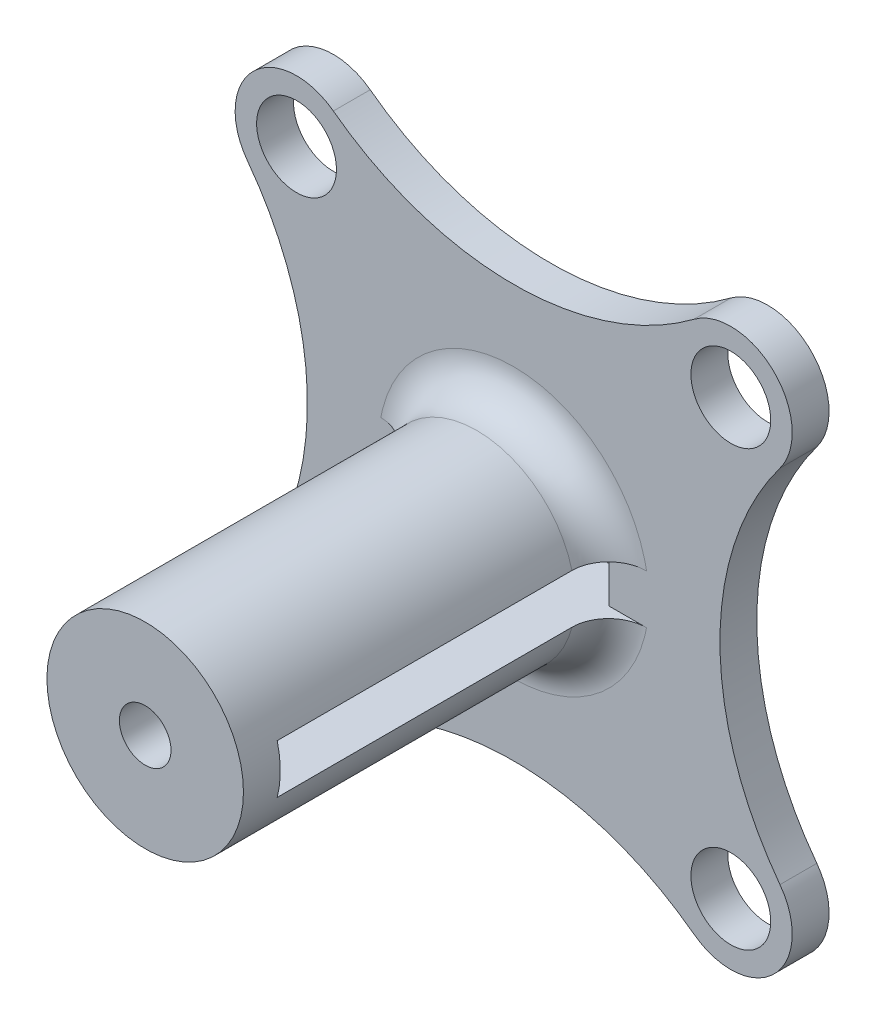
from build123d import *

# Parameters (mm, degrees)
CROQUIS1_R              = 3.2499999999997446
CROQUIS1_R_2            = 3.249999999997429
CROQUIS1_R_3            = 3.249999999998684
SALIENTE_EXTRUIR1_DEPTH = 3
CORTAR_EXTRUIR2_REACH   = 34.211
SALIENTE_EXTRUIR2_DEPTH = 30
SALIENTE_EXTRUIR3_START = -3
CROQUIS4_R              = 8.000000000001583
CROQUIS4_R_2            = 2.1
SALIENTE_EXTRUIR3_DEPTH = 3
REDONDEO1_R             = 3


with BuildPart() as part:
    # Croquis1 → Saliente-Extruir1 (new body)
    with BuildSketch(Plane.XY):
        with BuildLine():
            ThreePointArc((-14.681197845286842, 21.680313336544412), (-21.21320343559782, 21.213203435599436), (-21.680313336542973, 14.681197845289143))
            ThreePointArc((-21.680313336542973, 14.681197845289143), (-16.79377171834698, -4.4873e-13), (-21.680313336546256, -14.681197845289011))
            ThreePointArc((-21.680313336546256, -14.681197845289011), (-21.213203435602523, -21.213203435600768), (-14.68119784529118, -21.680313336546952))
            ThreePointArc((-14.68119784529118, -21.680313336546952), (-1.37456e-12, -16.793771718350733), (14.681197845287352, -21.68031333655022))
            ThreePointArc((14.681197845287352, -21.68031333655022), (21.21320343559837, -21.213203435605198), (21.680313336544117, -14.68119784529431))
            ThreePointArc((21.680313336544117, -14.68119784529431), (16.79377171834798, -4.8379e-12), (21.680313336547112, 14.681197845283641))
            ThreePointArc((21.680313336547112, 14.681197845283641), (21.213203435602864, 21.21320343559648), (14.681197845291681, 21.680313336541143))
            ThreePointArc((14.681197845291681, 21.680313336541143), (1.87813e-12, 16.793771718344924), (-14.681197845286842, 21.680313336544412))
        make_face()
        with Locations((-17.677669529663632, 17.677669529664712)):
            Circle(CROQUIS1_R, mode=Mode.SUBTRACT)
        with Locations((17.67766952966688, 17.677669529661795)):
            Circle(CROQUIS1_R_2, mode=Mode.SUBTRACT)
        with Locations((17.67766952966414, -17.677669529670524)):
            Circle(CROQUIS1_R_3, mode=Mode.SUBTRACT)
        with Locations((-17.677669529667213, -17.677669529666943)):
            Circle(CROQUIS1_R, mode=Mode.SUBTRACT)
    extrude(amount=SALIENTE_EXTRUIR1_DEPTH)

    # Croquis2 → Cortar-Extruir2 (cut, up to next)
    with BuildSketch(Plane.XY.offset(3), mode=Mode.PRIVATE) as cortar_extruir2_sk1:
        Polygon((3.0000001045733526, -6.64999997299992), (3.000000062696712, -2.0000000028022047), (7.7459667027131305, -1.9999999600613383), (7.745966666690224, 2.00000009954332), (3.000000026673777, 2.000000056802398), (2.999999984797136, 6.650000027000114), (-3.0000001046098235, 6.649999972965725), (-3.000000062733182, 2.00000000276801), (-7.745966702749602, 1.9999999600271434), (-7.7459666821165225, -2.00000003997286), (-3.000000026710248, -1.9999999972319937), (-2.9999999848336065, -6.6500000270343085), align=None)
    cortar_extruir2_tool1 = extrude(cortar_extruir2_sk1.sketch, amount=-CORTAR_EXTRUIR2_REACH, mode=Mode.PRIVATE) & part.part
    add(cortar_extruir2_tool1.solids().sort_by_distance((0, 0, 3))[0], mode=Mode.SUBTRACT)

    # Croquis3 → Saliente-Extruir2 (add)
    with BuildSketch(Plane.XY.offset(3)):
        with BuildLine():
            Line((3.000000026673777, 2.000000056802398), (7.745966666690224, 2.00000009954332))
            ThreePointArc((7.7459666667244, 2.000000099552144), (-7.205040071e-08, 8.000000000013381), (-7.745966702749601, 1.9999999600271456))
            Line((-7.745966702749602, 1.9999999600271434), (-3.000000062733182, 2.00000000276801))
            Line((-3.000000062733182, 2.00000000276801), (-3.0000001046098235, 6.649999972965725))
            Line((-3.000000104609824, 6.649999972965725), (2.999999984797136, 6.650000027000114))
            Line((2.999999984797136, 6.650000027000113), (3.000000026673777, 2.000000056802398))
        make_face()
        with BuildLine():
            Line((3.000000062696712, -2.0000000028022047), (3.0000001045733526, -6.64999997299992))
            Line((3.0000001045733526, -6.64999997299992), (-2.9999999848336065, -6.6500000270343085))
            Line((-2.9999999848336065, -6.6500000270343085), (-3.000000026710248, -1.9999999972319937))
            Line((-3.0000000267102482, -1.9999999972319937), (-7.7459666821165225, -2.00000003997286))
            ThreePointArc((-7.745966682108257, -2.000000039970724), (4.126157047e-08, -8.000000000013381), (7.745966702739044, -1.9999999600680332))
            Line((7.7459667027131305, -1.9999999600613383), (3.000000062696712, -2.0000000028022047))
        make_face()
    extrude(amount=SALIENTE_EXTRUIR2_DEPTH)

    # Croquis4 → Saliente-Extruir3 (add)
    with BuildSketch(Plane.XY.offset(33).offset(SALIENTE_EXTRUIR3_START)):
        with Locations(Location((0, 0, 0), (0, 0, 165.52248811))):
            Circle(CROQUIS4_R)
        Circle(CROQUIS4_R_2, mode=Mode.SUBTRACT)
    extrude(amount=SALIENTE_EXTRUIR3_DEPTH)

    # Redondeo1
    # the kernel refuses this fillet: 3 mm, written as the material it adds along each edge
    with BuildSketch(Plane(origin=(4.4e-16, 4.4e-16, 3), x_dir=(-0.22595414891367588, 0.9741379381733866, 0), z_dir=(0.9741379381733866, 0.22595414891367588, 0))) as redondeo1_piece_1_section:
        with BuildLine():
            CenterArc((8.000000000013381 + REDONDEO1_R, REDONDEO1_R), REDONDEO1_R, 180, 90)
            Line((8.000000000013383, REDONDEO1_R), (8.000000000013381, 0))
            Line((8.000000000013381, 0), (8.000000000013381 + REDONDEO1_R, 0))
        make_face()
    redondeo1_piece_1 = revolve(axis=Axis((4.4e-16, 4.4e-16, 3), (0, 0, 1)), revolution_arc=333.88201682059855, mode=Mode.PRIVATE)
    redondeo1_piece_1 = split(redondeo1_piece_1, bisect_by=Plane(origin=(-7.745966692433063, -3.99557857e-08, 3), z_dir=(1.0, 5.158269811289524e-09, 0)), keep=Keep.TOP, mode=Mode.PRIVATE)
    redondeo1_piece_1 = split(redondeo1_piece_1, bisect_by=Plane(origin=(7.745966684701678, 6.975805769e-08, 3), z_dir=(-1.0, -9.005726474694729e-09, 0)), keep=Keep.TOP, mode=Mode.PRIVATE)
    add(redondeo1_piece_1)
    with BuildSketch(Plane(origin=(4.4e-16, 4.4e-16, 3), x_dir=(-0.22595414891367588, 0.9741379381733866, 0), z_dir=(0.9741379381733866, 0.22595414891367588, 0))) as redondeo1_piece_2_section:
        with BuildLine():
            CenterArc((8.000000000013381 + REDONDEO1_R, REDONDEO1_R), REDONDEO1_R, 180, 90)
            Line((8.000000000013383, REDONDEO1_R), (8.000000000013381, 0))
            Line((8.000000000013381, 0), (8.000000000013381 + REDONDEO1_R, 0))
        make_face()
    redondeo1_piece_2 = revolve(axis=Axis((4.4e-16, 4.4e-16, 3), (0, 0, 1)), revolution_arc=333.88201682059855, mode=Mode.PRIVATE)
    redondeo1_piece_2 = split(redondeo1_piece_2, bisect_by=Plane(origin=(-1.801144813e-08, 2.0000000297851828, 3), z_dir=(-9.005724153490957e-09, 1.0, 0)), keep=Keep.TOP, mode=Mode.PRIVATE)
    add(redondeo1_piece_2)
    with BuildSketch(Plane(origin=(4.4e-16, 4.4e-16, 3), x_dir=(-0.22595414891367588, 0.9741379381733866, 0), z_dir=(0.9741379381733866, 0.22595414891367588, 0))) as redondeo1_piece_3_section:
        with BuildLine():
            CenterArc((8.000000000013381 + REDONDEO1_R, REDONDEO1_R), REDONDEO1_R, 180, 90)
            Line((8.000000000013383, REDONDEO1_R), (8.000000000013381, 0))
            Line((8.000000000013381, 0), (8.000000000013381 + REDONDEO1_R, 0))
        make_face()
    redondeo1_piece_3 = revolve(axis=Axis((4.4e-16, 4.4e-16, 3), (0, 0, 1)), revolution_arc=333.88201682059855, mode=Mode.PRIVATE)
    redondeo1_piece_3 = split(redondeo1_piece_3, bisect_by=Plane(origin=(1.801144902e-08, -2.0000000298193776, 3), z_dir=(9.005724153490959e-09, -1.0, 0)), keep=Keep.TOP, mode=Mode.PRIVATE)
    add(redondeo1_piece_3)
    with BuildSketch(Plane(origin=(0, -4.4e-16, 3), x_dir=(0.22595415641693267, -0.9741379364329841, 0), z_dir=(-0.9741379364329841, -0.22595415641693267, 0))) as redondeo1_piece_4_section:
        with BuildLine():
            CenterArc((8.000000000013381 + REDONDEO1_R, REDONDEO1_R), REDONDEO1_R, 180, 90)
            Line((8.000000000013381, REDONDEO1_R), (8.000000000013381, 0))
            Line((8.000000000013381, 0), (8.000000000013381 + REDONDEO1_R, 0))
        make_face()
    redondeo1_piece_4 = revolve(axis=Axis((0, -4.4e-16, 3), (0, 0, 1)), revolution_arc=333.8820163789793, mode=Mode.PRIVATE)
    redondeo1_piece_4 = split(redondeo1_piece_4, bisect_by=Plane(origin=(-7.745966692433063, -3.995578659e-08, 3), z_dir=(1.0, 5.158269811289524e-09, 0)), keep=Keep.TOP, mode=Mode.PRIVATE)
    redondeo1_piece_4 = split(redondeo1_piece_4, bisect_by=Plane(origin=(7.745966684701678, 6.97580568e-08, 3), z_dir=(-1.0, -9.005726474694729e-09, 0)), keep=Keep.TOP, mode=Mode.PRIVATE)
    add(redondeo1_piece_4)
    with BuildSketch(Plane(origin=(0, -4.4e-16, 3), x_dir=(0.22595415641693267, -0.9741379364329841, 0), z_dir=(-0.9741379364329841, -0.22595415641693267, 0))) as redondeo1_piece_5_section:
        with BuildLine():
            CenterArc((8.000000000013381 + REDONDEO1_R, REDONDEO1_R), REDONDEO1_R, 180, 90)
            Line((8.000000000013381, REDONDEO1_R), (8.000000000013381, 0))
            Line((8.000000000013381, 0), (8.000000000013381 + REDONDEO1_R, 0))
        make_face()
    redondeo1_piece_5 = revolve(axis=Axis((0, -4.4e-16, 3), (0, 0, 1)), revolution_arc=333.8820163789793, mode=Mode.PRIVATE)
    redondeo1_piece_5 = split(redondeo1_piece_5, bisect_by=Plane(origin=(1.801144858e-08, -2.0000000298193776, 3), z_dir=(9.005724153490959e-09, -1.0, 0)), keep=Keep.TOP, mode=Mode.PRIVATE)
    add(redondeo1_piece_5)
    with BuildSketch(Plane(origin=(0, -4.4e-16, 3), x_dir=(0.22595415641693267, -0.9741379364329841, 0), z_dir=(-0.9741379364329841, -0.22595415641693267, 0))) as redondeo1_piece_6_section:
        with BuildLine():
            CenterArc((8.000000000013381 + REDONDEO1_R, REDONDEO1_R), REDONDEO1_R, 180, 90)
            Line((8.000000000013381, REDONDEO1_R), (8.000000000013381, 0))
            Line((8.000000000013381, 0), (8.000000000013381 + REDONDEO1_R, 0))
        make_face()
    redondeo1_piece_6 = revolve(axis=Axis((0, -4.4e-16, 3), (0, 0, 1)), revolution_arc=333.8820163789793, mode=Mode.PRIVATE)
    redondeo1_piece_6 = split(redondeo1_piece_6, bisect_by=Plane(origin=(-1.801144858e-08, 2.0000000297851828, 3), z_dir=(-9.005724153490957e-09, 1.0, 0)), keep=Keep.TOP, mode=Mode.PRIVATE)
    add(redondeo1_piece_6)


solid = part.part
